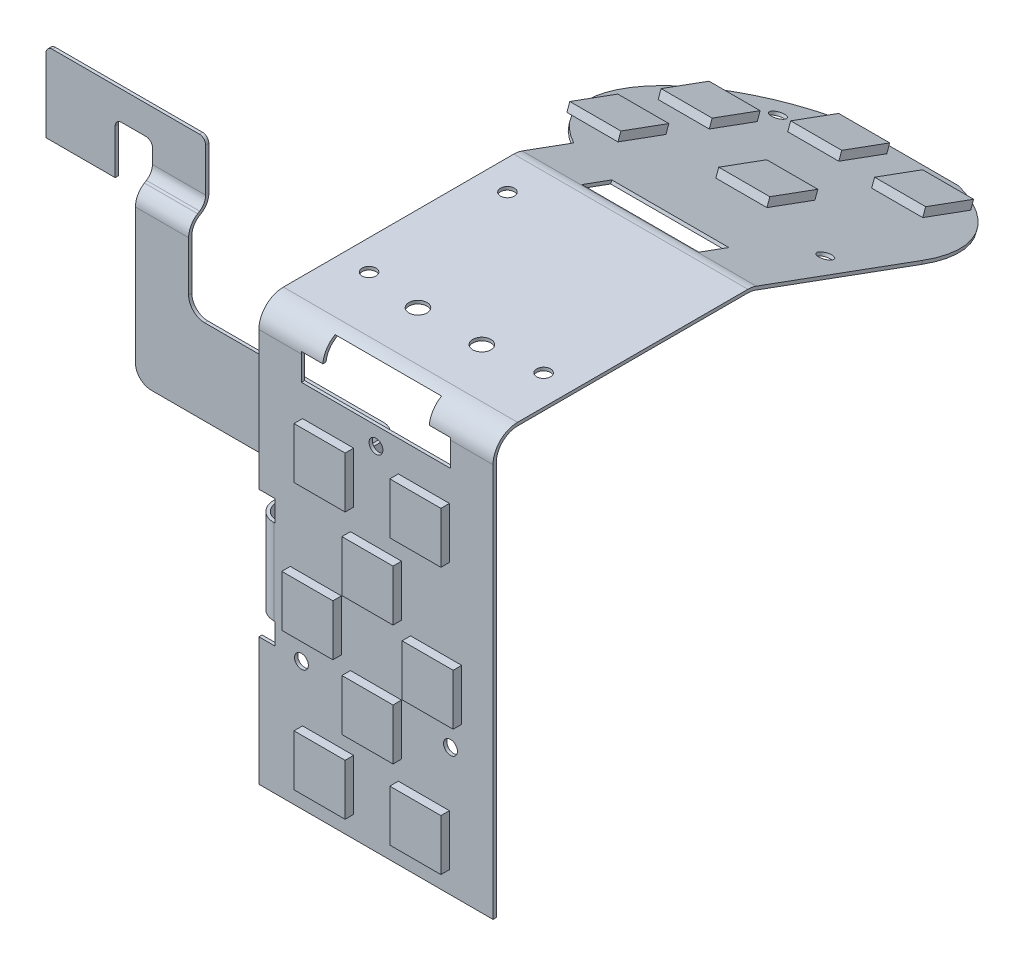
from build123d import *

# Parameters (mm, degrees)
EXTRUDE_1_DEPTH     = 22
CUT_EXTRUDE_1_DEPTH = 4
CUT_EXTRUDE_2_DEPTH = 64.319089808
SKETCH_3_3_R        = 14
EXTRUDE_2_DEPTH     = 0.3
SKETCH_4_W          = 4.8
SKETCH_4_H          = 4.8
EXTRUDE_3_DEPTH     = 0.8
SKETCH_5_R          = 0.85
CUT_EXTRUDE_3_DEPTH = 66.186911573
SKETCH_6_W          = 11
SKETCH_6_H          = 3
CUT_EXTRUDE_4_DEPTH = 1
SKETCH_7_W          = 4.8
SKETCH_7_H          = 4.8
EXTRUDE_4_DEPTH     = 0.8
SKETCH_9_W          = 1.5
SKETCH_9_H          = 0.3
CUT_EXTRUDE_5_DEPTH = 10
EXTRUDE_5_DEPTH     = 8
EXTRUDE_6_DEPTH     = 0.3
EXTRUDE_7_DEPTH     = 5
EXTRUDE_8_DEPTH     = 0.3
SKETCH_14_R         = 0.65
SKETCH_14_W         = 12
SKETCH_14_H         = 2
CUT_EXTRUDE_6_DEPTH = 4
SKETCH_15_R         = 0.65
CUT_EXTRUDE_7_DEPTH = 4
EXTRUDE_9_DEPTH     = 0.3
SKETCH_16_R         = 0.65
CUT_EXTRUDE_8_DEPTH = 4
SKETCH_18_W         = 4.8
SKETCH_18_H         = 4.8
EXTRUDE_10_DEPTH    = 0.8


with BuildPart() as part:
    # 草图1 → 凸台-拉伸1 (new body)
    with BuildSketch(Plane(origin=(0, 0, 0), x_dir=(0, 0, -1), z_dir=(1, 0, 0))):
        with BuildLine():
            Line((0, -25), (0, -2))
            ThreePointArc((0, -2), (0.585786438, -0.585786438), (2, 0))
            Line((2, 0), (23.64572618, 0))
            ThreePointArc((23.64572618, 0), (23.99456936, -0.030657867), (24.332717753, -0.121691565))
            Line((24.332717753, -0.121691565), (52.174626532, -10.304873595))
            Line((52.174626532, -10.304873595), (52.277675268, -10.023127329))
            Line((52.277675268, -10.023127329), (24.435766489, 0.160054701))
            ThreePointArc((24.435766489, 0.160054701), (24.046895837, 0.264743453), (23.64572618, 0.3))
            Line((23.64572618, 0.3), (2, 0.3))
            ThreePointArc((2, 0.3), (0.373654403, -0.373654403), (-0.3, -2))
            Line((-0.3, -2), (-0.3, -25))
            Line((-0.3, -25), (0, -25))
        make_face()
    extrude(amount=EXTRUDE_1_DEPTH)

    # 草图2 → 切除-拉伸1 (cut)
    with BuildSketch(Plane.XY.offset(0.3)):
        Polygon((4, -4.3), (18, -4.3), (18, -1.8), (16, -1.8), (16, 0), (6, 0), (6, -1.8), (4, -1.8), align=None)
    extrude(amount=-CUT_EXTRUDE_1_DEPTH, mode=Mode.SUBTRACT)

    # 草图3 → 切除-拉伸2 (cut, through all)
    with BuildSketch(Plane(origin=(0, 8.024038665, -2.934793264), x_dir=(1, 0, 0), z_dir=(0, 0.9391542177229502, -0.3434957864853564))):
        with BuildLine():
            ThreePointArc((13.196152423, 52.539701225), (19.591939741, 47.38998358), (22, 39.539701225))
            Line((22, 39.539701225), (22, 52.539701225))
            Line((22, 52.539701225), (13.196152423, 52.539701225))
        make_face()
        with BuildLine():
            ThreePointArc((0, 51.028826518), (1.358818231, 51.864258204), (2.803847577, 52.539701225))
            Line((2.803847577, 52.539701225), (0, 52.539701225))
            Line((0, 52.539701225), (0, 51.028826518))
        make_face()
    extrude(amount=-CUT_EXTRUDE_2_DEPTH, mode=Mode.SUBTRACT)

    # 草图3<3> → 凸台-拉伸2 (add)
    with BuildSketch(Plane(origin=(0, 8.024038665, -2.934793264), x_dir=(1, 0, 0), z_dir=(0, 0.9391542177229502, -0.3434957864853564))):
        with Locations((8, 39.539701225)):
            Circle(SKETCH_3_3_R)
    extrude(amount=-EXTRUDE_2_DEPTH)

    # 草图4 → 凸台-拉伸3 (add)
    with BuildSketch(Plane.XY.offset(0.3)):
        with Locations((11, -16.55)):
            Rectangle(SKETCH_4_W, SKETCH_4_H)
        with Locations((11, -27.85)):
            Rectangle(SKETCH_4_W, SKETCH_4_H)
        with Locations((5.35, -22.2)):
            Rectangle(SKETCH_4_W, SKETCH_4_H)
        with Locations((16.65, -22.2)):
            Rectangle(SKETCH_4_W, SKETCH_4_H)
    extrude(amount=EXTRUDE_3_DEPTH)


with BuildPart() as extrude_3_piece_1:
    # of the separate pieces the step leaves, piece 1, a body of its own (extrude_3_pieces)
    add(part.part.solids().sort_by_distance((0, -2, 0.3))[0])

    # 草图5 → 切除-拉伸3 (cut, through all)
    with BuildSketch(Plane(origin=(0, 0.3, 0), x_dir=(1, 0, 0), z_dir=(0, 1, 0))):
        with Locations((8, 6.64572618)):
            Circle(SKETCH_5_R)
        with Locations((14, 6.64572618)):
            Circle(SKETCH_5_R)
    extrude(amount=-CUT_EXTRUDE_3_DEPTH, mode=Mode.SUBTRACT)

    # 草图6 → 切除-拉伸4 (cut)
    with BuildSketch(Plane(origin=(0, 8.024038665, -2.934793264), x_dir=(1, 0, 0), z_dir=(0, 0.9391542177229502, -0.3434957864853564))):
        with Locations((11, 24.5)):
            Rectangle(SKETCH_6_W, SKETCH_6_H)
    extrude(amount=-CUT_EXTRUDE_4_DEPTH, mode=Mode.SUBTRACT)

    # 草图7 → 凸台-拉伸4 (add)
    with BuildSketch(Plane(origin=(0, 8.024038665, -2.934793264), x_dir=(1, 0, 0), z_dir=(0, 0.9391542177229502, -0.3434957864853564))):
        with Locations((9.738477049, 36.851443585)):
            Rectangle(SKETCH_7_W, SKETCH_7_H)
        with Locations((14.118767038, 47.774445204)):
            Rectangle(SKETCH_7_W, SKETCH_7_H)
        with Locations((5.219570287, 48.855656024)):
            Rectangle(SKETCH_7_W, SKETCH_7_H)
        with Locations((-1.489481468, 43.037611303)):
            Rectangle(SKETCH_7_W, SKETCH_7_H)
        with Locations((-1.651961899, 34.079108149)):
            Rectangle(SKETCH_7_W, SKETCH_7_H)
    extrude(amount=EXTRUDE_4_DEPTH)

    # 草图9 → 切除-拉伸5 (cut)
    with BuildSketch(Plane.XZ.offset(25)):
        with Locations((0.75, 0.15)):
            Rectangle(SKETCH_9_W, SKETCH_9_H)
    extrude(amount=-CUT_EXTRUDE_5_DEPTH, mode=Mode.SUBTRACT)

    # 草图10 → 凸台-拉伸5 (add)
    with BuildSketch(Plane.XZ.offset(25)):
        with BuildLine():
            Line((1.5, 0), (1.4, 0))
            ThreePointArc((1.4, 0), (0.339339828, -0.439339828), (-0.1, -1.5))
            Line((-0.1, -1.5), (-0.1, -11.5))
            ThreePointArc((-0.1, -11.5), (-0.539339828, -12.560660172), (-1.6, -13))
            Line((-1.6, -13), (-17.6, -13))
            Line((-17.6, -13), (-17.6, -12.7))
            Line((-17.6, -12.7), (-1.6, -12.7))
            ThreePointArc((-1.6, -12.7), (-0.751471863, -12.348528137), (-0.4, -11.5))
            Line((-0.4, -11.5), (-0.4, -1.5))
            ThreePointArc((-0.4, -1.5), (0.127207794, -0.227207794), (1.4, 0.3))
            Line((1.4, 0.3), (1.5, 0.3))
            Line((1.5, 0.3), (1.5, 0))
        make_face()
    extrude(amount=-EXTRUDE_5_DEPTH)

    # 草图11 → 凸台-拉伸6 (add)
    with BuildSketch(Plane.XY.offset(-12.7)):
        with BuildLine():
            Line((-17.6, -17), (-17.6, -25))
            Line((-17.6, -25), (-23.1, -25))
            ThreePointArc((-23.1, -25), (-24.160660172, -24.560660172), (-24.6, -23.5))
            Line((-24.6, -23.5), (-24.6, -11))
            Line((-24.6, -11), (-19.6, -11))
            Line((-19.6, -11), (-19.6, -15.5))
            ThreePointArc((-19.6, -15.5), (-19.160660172, -16.560660172), (-18.1, -17))
            Line((-18.1, -17), (-17.6, -17))
        make_face()
    extrude(amount=-EXTRUDE_6_DEPTH)

    # 草图12 → 凸台-拉伸7 (add)
    with BuildSketch(Plane.ZY.offset(24.6)):
        with BuildLine():
            Line((-13, -11), (-13, -10.831371462))
            ThreePointArc((-13, -10.831371462), (-13.188036278, -10.104218664), (-13.70500159, -9.559374006))
            Line((-13.70500159, -9.559374006), (-13.89499841, -9.440625994))
            ThreePointArc((-13.89499841, -9.440625994), (-14.411963722, -8.895781336), (-14.6, -8.168628538))
            Line((-14.6, -8.168628538), (-14.6, -8))
            Line((-14.6, -8), (-14.3, -8))
            Line((-14.3, -8), (-14.3, -8.168628538))
            ThreePointArc((-14.3, -8.168628538), (-14.149570977, -8.750350777), (-13.735998728, -9.186226503))
            Line((-13.735998728, -9.186226503), (-13.546001908, -9.304974515))
            ThreePointArc((-13.546001908, -9.304974515), (-12.925643534, -9.958788104), (-12.7, -10.831371462))
            Line((-12.7, -10.831371462), (-12.7, -11))
            Line((-12.7, -11), (-13, -11))
        make_face()
    extrude(amount=-EXTRUDE_7_DEPTH)

    # 草图13 → 凸台-拉伸8 (add)
    with BuildSketch(Plane.XY.offset(-14.3)):
        with BuildLine():
            Line((-24.6, -8), (-19.6, -8))
            Line((-19.6, -8), (-19.6, -4.1))
            ThreePointArc((-19.6, -4.1), (-19.775735931, -3.675735931), (-20.2, -3.5))
            Line((-20.2, -3.5), (-34, -3.5))
            ThreePointArc((-34, -3.5), (-34.424264069, -3.675735931), (-34.6, -4.1))
            Line((-34.6, -4.1), (-34.6, -11))
            Line((-34.6, -11), (-28.1, -11))
            Line((-28.1, -11), (-28.1, -6.8))
            ThreePointArc((-28.1, -6.8), (-27.924264069, -6.375735931), (-27.5, -6.2))
            Line((-27.5, -6.2), (-25.2, -6.2))
            ThreePointArc((-25.2, -6.2), (-24.775735931, -6.375735931), (-24.6, -6.8))
            Line((-24.6, -6.8), (-24.6, -8))
        make_face()
    extrude(amount=-EXTRUDE_8_DEPTH)

    # 草图14 → 切除-拉伸6 (cut)
    with BuildSketch(Plane(origin=(0, 8.024038665, -2.934793264), x_dir=(1, 0, 0), z_dir=(0, 0.9391542177229502, -0.3434957864853564))):
        with Locations((0.5, 47.950575932)):
            Circle(SKETCH_14_R)
        with Locations((19.5, 32.450575932)):
            Circle(SKETCH_14_R)
        with Locations((8, 53.550575932)):
            Rectangle(SKETCH_14_W, SKETCH_14_H)
    extrude(amount=-CUT_EXTRUDE_6_DEPTH, mode=Mode.SUBTRACT)

    # 草图15 → 切除-拉伸7 (cut)
    with BuildSketch(Plane(origin=(0, 0.3, 0), x_dir=(1, 0, 0), z_dir=(0, 1, 0))):
        with Locations((2.8, 20.25)):
            Circle(SKETCH_15_R)
        with Locations((2.8, 7.25)):
            Circle(SKETCH_15_R)
        with Locations((19.2, 7.25)):
            Circle(SKETCH_15_R)
    extrude(amount=-CUT_EXTRUDE_7_DEPTH, mode=Mode.SUBTRACT)

    # 草图17 → 凸台-拉伸9 (add)
    with BuildSketch(Plane.XY.offset(0.3)):
        Polygon((22, -25), (22, -39), (0, -39), (0, -27), (1.5, -27), (1.5, -25), align=None)
    extrude(amount=-EXTRUDE_9_DEPTH)

    # 草图16 → 切除-拉伸8 (cut)
    with BuildSketch(Plane.XY.offset(0.3)):
        with Locations((11, -6)):
            Circle(SKETCH_16_R)
        with Locations((4, -27)):
            Circle(SKETCH_16_R)
        with Locations((18, -27)):
            Circle(SKETCH_16_R)
    extrude(amount=-CUT_EXTRUDE_8_DEPTH, mode=Mode.SUBTRACT)

    # 草图18 → 凸台-拉伸10 (add)
    with BuildSketch(Plane.XY.offset(0.3)):
        with Locations((6.5, -34.6)):
            Rectangle(SKETCH_18_W, SKETCH_18_H)
        with Locations((15.5, -34.6)):
            Rectangle(SKETCH_18_W, SKETCH_18_H)
        with Locations((6.5, -9.6)):
            Rectangle(SKETCH_18_W, SKETCH_18_H)
        with Locations((15.5, -9.6)):
            Rectangle(SKETCH_18_W, SKETCH_18_H)
    extrude(amount=EXTRUDE_10_DEPTH)


with BuildPart() as extrude_3_piece_2:
    # of the separate pieces the step leaves, piece 2, a body of its own (extrude_3_pieces)
    add(part.part.solids().sort_by_distance((8.6, -25.45, 0.3))[0])


solid = Compound([extrude_3_piece_1.part, extrude_3_piece_2.part])
